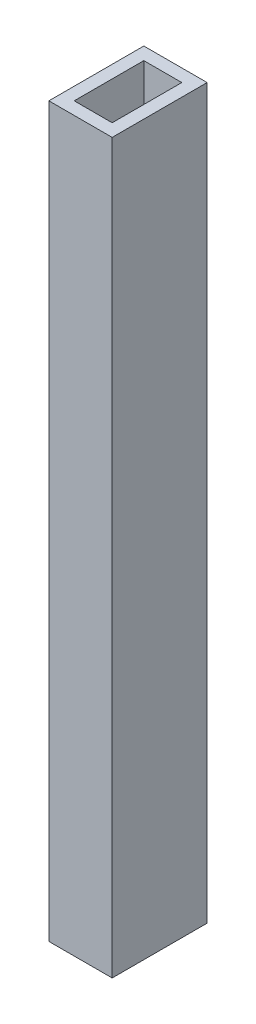
from build123d import *

# Parameters (mm, degrees)
SKETCH1_W           = 10
SKETCH1_H           = 15
BOSS_EXTRUDE1_DEPTH = 115
SKETCH2_W           = 3
SKETCH2_H           = 4
CUT_EXTRUDE1_DEPTH  = 3
SHELL1_START        = 90
SHELL1_OUTLINE_W    = 6
SHELL1_OUTLINE_H    = 11
SHELL1_DEPTH        = 25


# Read off the part's stored shape, not the designer's step: Shell1
with BuildPart() as part:
    # Sketch1 → Boss-Extrude1 (new body)
    with BuildSketch(Plane(origin=(0, 0, 0), x_dir=(1, 0, 0), z_dir=(0, 1, 0))):
        Rectangle(SKETCH1_W, SKETCH1_H)
    extrude(amount=BOSS_EXTRUDE1_DEPTH)

    # Sketch2 → Cut-Extrude1 (cut)
    with BuildSketch(Plane.XZ):
        Rectangle(SKETCH2_W, SKETCH2_H)
    extrude(amount=-CUT_EXTRUDE1_DEPTH, mode=Mode.SUBTRACT)

    # Shell1 outline → Shell1 (cut)
    with BuildSketch(Plane(origin=(0, 0, 0), x_dir=(1, 0, 0), z_dir=(0, 1, 0)).offset(SHELL1_START)):
        Rectangle(SHELL1_OUTLINE_W, SHELL1_OUTLINE_H)
    extrude(amount=SHELL1_DEPTH, mode=Mode.SUBTRACT)


solid = part.part
